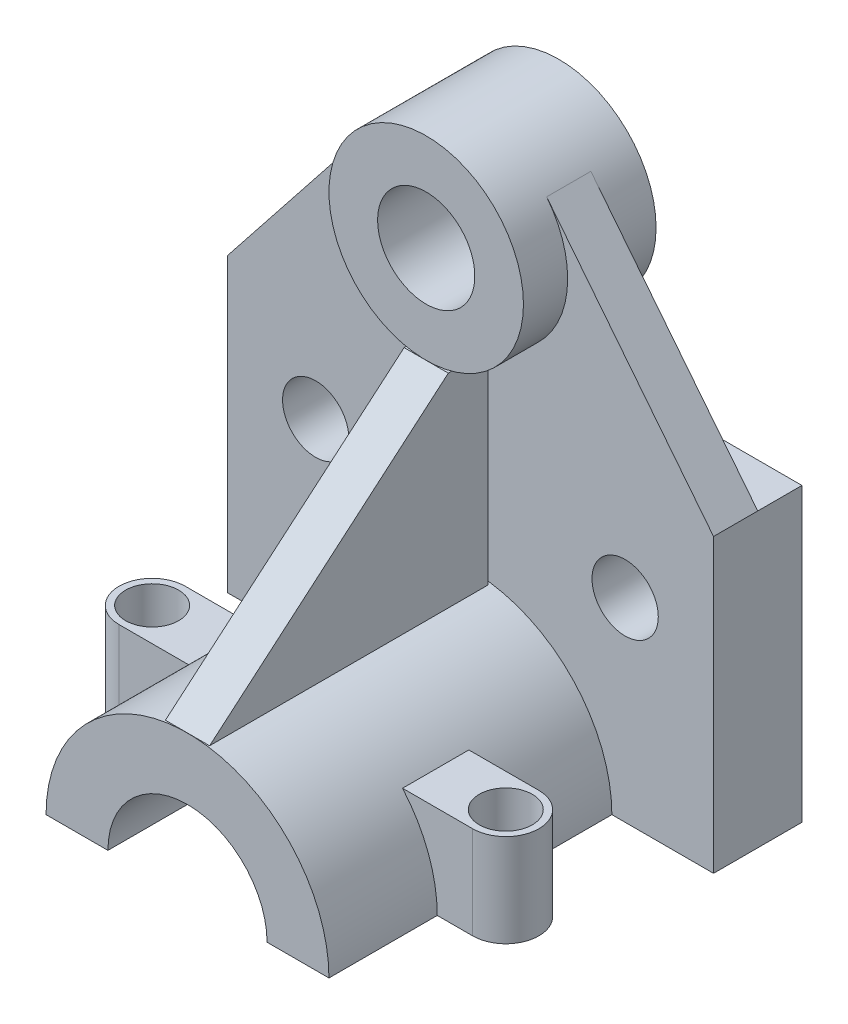
from build123d import *

# Parameters (mm, degrees)
SKETCH2_W                = 110
SKETCH2_H                = 66
BOSS_EXTRUDE1_DEPTH      = 20
BOSS_EXTRUDE3_DEPTH      = 10
BOSS_EXTRUDE5_DEPTH      = 10
BOSS_EXTRUDE5_DEPTH_BACK = 20
SKETCH4_R                = 22
SKETCH4_R_2              = 11
SKETCH5_R                = 11
CUT_EXTRUDE1_DEPTH       = 91
BOSS_EXTRUDE6_DEPTH      = 64
SKETCH10_W               = 10
SKETCH10_H               = 147.367843809
EXTRUDE_THIN1_DEPTH      = 15
BOSS_EXTRUDE9_DEPTH      = 5
BOSS_EXTRUDE9_DEPTH_BACK = 5
SKETCH12_W               = 15
SKETCH12_H               = 147.367843809
CUT_EXTRUDE2_DEPTH       = 83
CUT_EXTRUDE3_DEPTH       = 83
BOSS_EXTRUDE12_DEPTH     = 21
BOSS_EXTRUDE12_2_DEPTH   = 21
LOFT2_START              = -33
LOFT2_OUTLINE_W          = 64
LOFT2_OUTLINE_H          = 15
LOFT2_DEPTH              = 21
CUT_EXTRUDE4_START       = -21
SKETCH16_R               = 18
CUT_EXTRUDE4_DEPTH       = 21
CUT_EXTRUDE5_DEPTH       = 21
SKETCH25_W               = 10
SKETCH25_H               = 45.999998161
BOSS_EXTRUDE15_DEPTH     = 9


# Read off the part's stored shape, not the designer's step: Loft2
with BuildPart() as part:
    # Sketch2 → Boss-Extrude1 (new body)
    with BuildSketch(Plane.XY):
        Rectangle(SKETCH2_W, SKETCH2_H)
    extrude(amount=-BOSS_EXTRUDE1_DEPTH)

    # Sketch3 → Boss-Extrude3 (add)
    with BuildSketch(Plane.XY):
        with BuildLine():
            Line((-55, 33), (55, 33))
            Line((55, 33), (17.244826829, 80.660747731))
            ThreePointArc((17.244826829, 80.660747731), (3.5e-08, 89.000001839), (-17.244826785, 80.660747787))
            Line((-17.244826785, 80.660747787), (-55, 33))
        make_face()
    extrude(amount=-BOSS_EXTRUDE3_DEPTH)

    # Sketch4 → Boss-Extrude5 (add, two sides: drawn at the far end of the back side and taken through both)
    with BuildSketch(Plane.XY.offset(-BOSS_EXTRUDE5_DEPTH_BACK)):
        with Locations((0, 67)):
            Circle(SKETCH4_R)
        with Locations(Location((0, 67, 0), (0, 0, 180))):
            Circle(SKETCH4_R_2, mode=Mode.SUBTRACT)
    extrude(amount=BOSS_EXTRUDE5_DEPTH + BOSS_EXTRUDE5_DEPTH_BACK)

    # Sketch5 → Cut-Extrude1 (cut)
    with BuildSketch(Plane.XY):
        with Locations(Location((0, 67, 0), (0, 0, 180))):
            Circle(SKETCH5_R)
    extrude(amount=-CUT_EXTRUDE1_DEPTH, mode=Mode.SUBTRACT)

    # Sketch6 → Boss-Extrude6 (add)
    with BuildSketch(Plane.XY):
        with BuildLine():
            Line((-32, -33), (-18, -33))
            ThreePointArc((-18, -33), (0, -15), (18, -33))
            Line((18, -33), (32, -33))
            ThreePointArc((32, -33), (0, -1), (-32, -33))
        make_face()
    extrude(amount=BOSS_EXTRUDE6_DEPTH)

    # Sketch10 → Extrude-Thin1 (add)
    with BuildSketch(Plane(origin=(0, 0, -20), x_dir=(-1, 0, 0), z_dir=(0, 0, -1))):
        with Locations((5, 40.683921905)):
            Rectangle(SKETCH10_W, SKETCH10_H)
    extrude(amount=EXTRUDE_THIN1_DEPTH)

    # Sketch12 → Cut-Extrude2 (cut)
    with BuildSketch(Plane(origin=(0, 0, 0), x_dir=(0, 0, -1), z_dir=(1, 0, 0))):
        with Locations((27.5, 40.683921905)):
            Rectangle(SKETCH12_W, SKETCH12_H)
    extrude(amount=-CUT_EXTRUDE2_DEPTH, mode=Mode.SUBTRACT)

    # Sketch13 → Cut-Extrude3 (cut)
    with BuildSketch(Plane.XY):
        with BuildLine():
            Line((-42.5, 11), (-35, 11))
            Line((-35, 11), (-27.5, 11))
            ThreePointArc((-27.5, 11), (-35, 18.5), (-42.5, 11))
        make_face()
        with BuildLine():
            Line((-27.5, 11), (-35, 11))
            Line((-35, 11), (-42.5, 11))
            ThreePointArc((-42.5, 11), (-35, 3.5), (-27.5, 11))
        make_face()
        with BuildLine():
            ThreePointArc((42.5, 11), (35, 18.5), (27.5, 11))
            Line((27.5, 11), (35, 11))
            Line((35, 11), (42.5, 11))
        make_face()
        with BuildLine():
            Line((35, 11), (27.5, 11))
            ThreePointArc((27.5, 11), (35, 3.5), (42.5, 11))
            Line((42.5, 11), (35, 11))
        make_face()
    extrude(amount=-CUT_EXTRUDE3_DEPTH, mode=Mode.SUBTRACT)



with BuildPart() as body_2:
    # Sketch11 → Boss-Extrude9 (new, two sides: drawn at the far end of the back side and taken through both)
    with BuildSketch(Plane(origin=(0, 0, 0), x_dir=(0, 0, -1), z_dir=(1, 0, 0)).offset(-BOSS_EXTRUDE9_DEPTH_BACK)):
        Polygon((-10, -1), (-64, -1), (-10, 44.999998161), align=None)
    extrude(amount=BOSS_EXTRUDE9_DEPTH + BOSS_EXTRUDE9_DEPTH_BACK)

    # Sketch25 → Boss-Extrude15 (add)
    with BuildSketch(Plane(origin=(0, 0, 10), x_dir=(-1, 0, 0), z_dir=(0, 0, -1))):
        with Locations((0, 21.999999081)):
            Rectangle(SKETCH25_W, SKETCH25_H)
    extrude(amount=BOSS_EXTRUDE15_DEPTH)


with BuildPart() as body_3:
    # Sketch14 → Boss-Extrude12 (new body)
    with BuildSketch(Plane.XZ.offset(33)):
        with BuildLine():
            Line((-40, 24.5), (-32, 24.5))
            Line((-32, 24.5), (-32, 39.5))
            Line((-32, 39.5), (-40, 39.5))
            ThreePointArc((-40, 39.5), (-47.5, 32), (-40, 24.5))
        make_face()
    extrude(amount=-BOSS_EXTRUDE12_DEPTH)


with BuildPart() as body_4:
    # Sketch14 → Boss-Extrude12 2 (new body)
    with BuildSketch(Plane.XZ.offset(33)):
        with BuildLine():
            ThreePointArc((40, 24.5), (47.5, 32), (40, 39.5))
            Line((40, 39.5), (32, 39.5))
            Line((32, 39.5), (32, 24.5))
            Line((32, 24.5), (40, 24.5))
        make_face()
    extrude(amount=-BOSS_EXTRUDE12_2_DEPTH)


with BuildPart() as part_1:
    add(part.part)

    add(body_3.part)  # Loft2 merges body 3

    add(body_4.part)  # Loft2 merges body 4
    # Loft2 outline → Loft2 (add)
    with BuildSketch(Plane(origin=(0, 0, 0), x_dir=(1, 0, 0), z_dir=(0, 1, 0)).offset(LOFT2_START)):
        with Locations((0, -32)):
            Rectangle(LOFT2_OUTLINE_W, LOFT2_OUTLINE_H)
    extrude(amount=LOFT2_DEPTH)

    # Sketch16 → Cut-Extrude4 (cut)
    with BuildSketch(Plane.XY.offset(39.5).offset(CUT_EXTRUDE4_START)):
        with Locations((0, -33)):
            Circle(SKETCH16_R)
    extrude(amount=CUT_EXTRUDE4_DEPTH, mode=Mode.SUBTRACT)

    # Sketch17 → Cut-Extrude5 (cut)
    with BuildSketch(Plane(origin=(0, -12, 0), x_dir=(1, 0, 0), z_dir=(0, 1, 0))):
        with BuildLine():
            ThreePointArc((-34, -32), (-40, -26), (-46, -32))
            Line((-46, -32), (-34, -32))
        make_face()
        with BuildLine():
            Line((-34, -32), (-46, -32))
            ThreePointArc((-46, -32), (-40, -38), (-34, -32))
        make_face()
        with BuildLine():
            ThreePointArc((46, -32), (40, -26), (34, -32))
            Line((34, -32), (46, -32))
        make_face()
        with BuildLine():
            Line((46, -32), (34, -32))
            ThreePointArc((34, -32), (40, -38), (46, -32))
        make_face()
    extrude(amount=-CUT_EXTRUDE5_DEPTH, mode=Mode.SUBTRACT)


solid = Compound([body_2.part, part_1.part])
